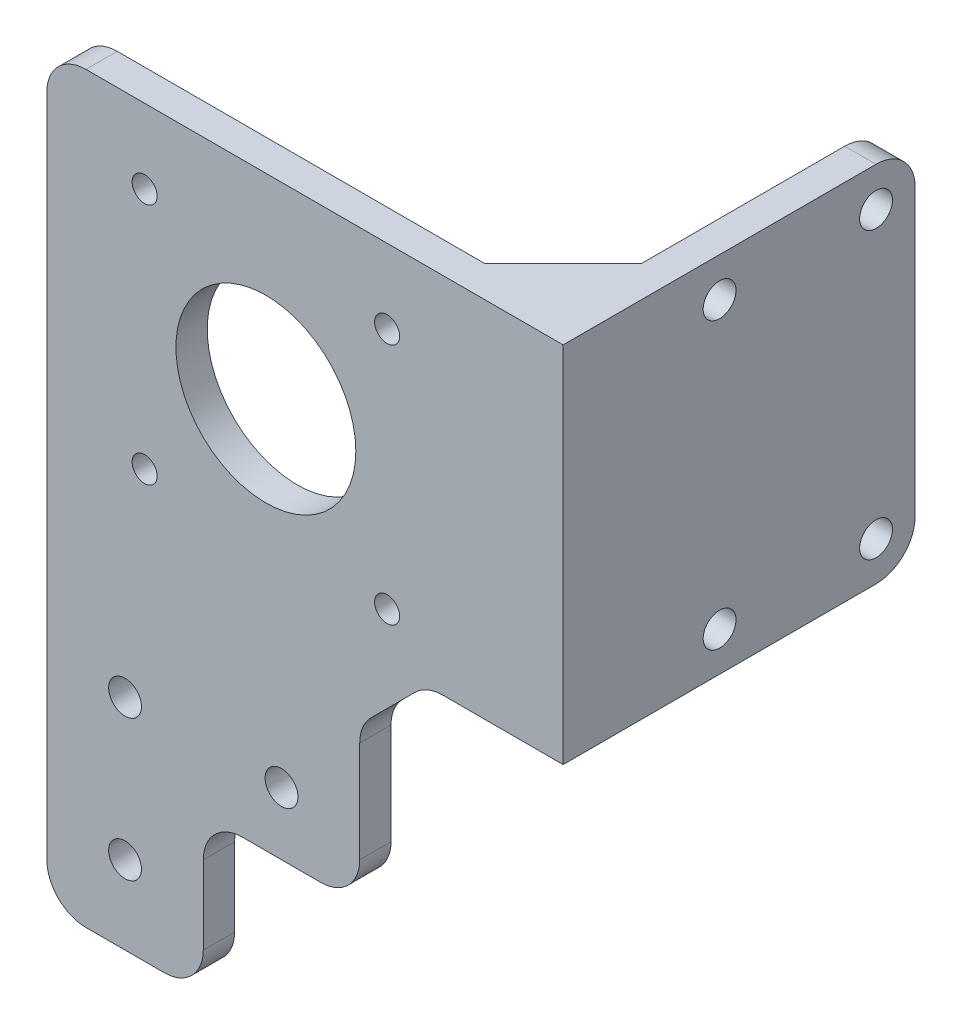
from build123d import *

# Parameters (mm, degrees)
MODEL_R         = 1.5999968
MODEL_R_2       = 2.0999958
MODEL_R_3       = 11.499977
EXTRUDE_1_DEPTH = 4
EXTRUDE_2_DEPTH = 4
FILLET_1_R      = 5
SKETCH_2_R      = 2.1
EXTRUDE_3_DEPTH = 4
EXTRUDE_4_DEPTH = 4


with BuildPart() as part:
    # Model → Бобышка-Вытянуть1 (new body)
    with BuildSketch(Plane.XY):
        with BuildLine():
            Line((274.028195208, 189.164211852), (274.028195208, 151.235355522))
            ThreePointArc((274.028195208, 151.235355522), (273.647593631, 149.321942187), (272.563732042, 147.699828687))
            Line((272.563732042, 147.699828687), (265.492678373, 140.628775017))
            ThreePointArc((265.492678373, 140.628775017), (264.408816784, 139.006661518), (264.028215208, 137.093248183))
            Line((264.028215208, 137.093248183), (264.028215208, 124.164341852))
            ThreePointArc((264.028215208, 124.164341852), (262.563752042, 120.628815017), (259.028225208, 119.164351852))
            Line((259.028225208, 119.164351852), (249.028245208, 119.164351852))
            ThreePointArc((249.028245208, 119.164351852), (245.492718373, 117.699888687), (244.028255208, 114.164361852))
            Line((244.028255208, 114.164361852), (244.028255208, 104.164381852))
            ThreePointArc((244.028255208, 104.164381852), (242.563792042, 100.628855017), (239.028265208, 99.164391852))
            Line((239.028265208, 99.164391852), (229.028285208, 99.164391852))
            ThreePointArc((229.028285208, 99.164391852), (225.492758373, 100.628855017), (224.028295208, 104.164381852))
            Line((224.028295208, 104.164381852), (224.028295208, 189.164211852))
            ThreePointArc((224.028295208, 189.164211852), (225.492758373, 192.699738687), (229.028285208, 194.164201852))
            Line((229.028285208, 194.164201852), (269.028205208, 194.164201852))
            ThreePointArc((269.028205208, 194.164201852), (272.563732043, 192.699738687), (274.028195208, 189.164211852))
        make_face()
        with Locations((267.528208208, 184.664220852)):
            Circle(MODEL_R, mode=Mode.SUBTRACT)
        with Locations((267.528208208, 153.664282852)):
            Circle(MODEL_R, mode=Mode.SUBTRACT)
        with Locations((236.528270208, 153.664282852)):
            Circle(MODEL_R, mode=Mode.SUBTRACT)
        with Locations((236.528270208, 184.664220852)):
            Circle(MODEL_R, mode=Mode.SUBTRACT)
        with Locations((254.028235208, 127.164335852)):
            Circle(MODEL_R_2, mode=Mode.SUBTRACT)
        with Locations((234.028275208, 127.164335852)):
            Circle(MODEL_R_2, mode=Mode.SUBTRACT)
        with Locations((234.028275208, 109.164371852)):
            Circle(MODEL_R_2, mode=Mode.SUBTRACT)
        with Locations((252.028239208, 169.164251852)):
            Circle(MODEL_R_3, mode=Mode.SUBTRACT)
    extrude(amount=EXTRUDE_1_DEPTH)

    # Эскиз1 → Бобышка-Вытянуть2 (add)
    with BuildSketch(Plane(origin=(0, 0, 0), x_dir=(-1, 0, 0), z_dir=(0, 0, -1))):
        Polygon((-274.028195208, 194.164201852), (-286.028195208, 194.164201852), (-286.028195208, 147.699828687), (-274.028195208, 147.699828687), (-271.528200208, 147.699828687), (-271.528200208, 152.064286052), (-274.028195208, 152.064286052), (-274.028195208, 189.164211852), (-269.028205208, 189.164211852), (-269.028205208, 194.164201852), align=None)
    extrude(amount=-EXTRUDE_2_DEPTH)

    # Скругление1
    fillet_1_edges = [part.edges().sort_by_distance(p)[0] for p in [
        (272.563732042, 147.699828687, 2),
    ]]
    fillet(fillet_1_edges, radius=FILLET_1_R)

    # Эскиз2 → Бобышка-Вытянуть3 (add)
    with BuildSketch(Plane(origin=(286.028195208, 0, 0), x_dir=(0, 0, -1), z_dir=(1, 0, 0))):
        with BuildLine():
            Line((-4, 194.164201852), (36, 194.164201852))
            ThreePointArc((36, 194.164201852), (39.535533906, 192.699735758), (41, 189.164201852))
            Line((41, 189.164201852), (41, 152.699828687))
            ThreePointArc((41, 152.699828687), (39.535533906, 149.164294781), (36, 147.699828687))
            Line((36, 147.699828687), (-4, 147.699828687))
            Line((-4, 147.699828687), (-4, 194.164201852))
        make_face()
        with Locations((36, 189.164201852)):
            Circle(SKETCH_2_R, mode=Mode.SUBTRACT)
        with Locations((36, 152.699828687)):
            Circle(SKETCH_2_R, mode=Mode.SUBTRACT)
        with Locations((16, 189.164201852)):
            Circle(SKETCH_2_R, mode=Mode.SUBTRACT)
        with Locations((16, 152.699828687)):
            Circle(SKETCH_2_R, mode=Mode.SUBTRACT)
    extrude(amount=EXTRUDE_3_DEPTH)

    # Эскиз3 → Бобышка-Вытянуть4 (add)
    with BuildSketch(Plane(origin=(0, 194.164201852, 0), x_dir=(1, 0, 0), z_dir=(0, 1, 0))):
        Polygon((286.028195208, 0), (286.028195208, 10), (276.028195208, 0), align=None)
    extrude_4 = extrude(amount=-EXTRUDE_4_DEPTH)

    # Зеркальное отражение1: Бобышка-Вытянуть4 across plane
    add(extrude_4.mirror(Plane.ZX.offset(170.93201527)))


solid = part.part
